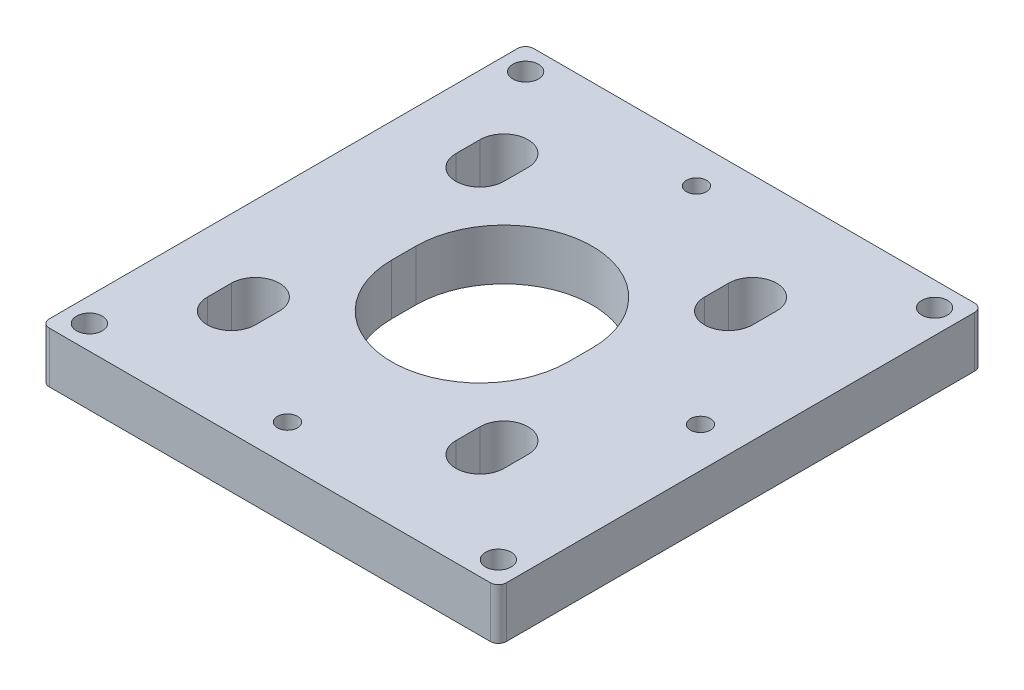
from build123d import *

# Parameters (mm, degrees)
SKETCH1_W                   = 57
SKETCH1_H                   = 60.4
BOSS_EXTRUDE1_DEPTH         = 6.35
M3_CLEARANCE_HOLE1_D        = 3.2
TAP_DRILL_FOR_M3X0_5_TAP1_D = 2.5
FILLET1_R                   = 1


with BuildPart() as part:
    # Sketch1 → Boss-Extrude1 (new body)
    with BuildSketch(Plane(origin=(0, 0, 0), x_dir=(1, 0, 0), z_dir=(0, 1, 0))):
        with Locations((2.5, 0)):
            Rectangle(SKETCH1_W, SKETCH1_H)
        with BuildLine():
            Line((-11, -1.5), (-11, 1.5))
            ThreePointArc((-11, 1.5), (0, 12.5), (11, 1.5))
            Line((11, 1.5), (11, -1.5))
            ThreePointArc((11, -1.5), (0, -12.5), (-11, -1.5))
        make_face(mode=Mode.SUBTRACT)
        with BuildLine():
            Line((-18.5, 14), (-18.5, 17))
            ThreePointArc((-18.5, 17), (-15.5, 20), (-12.5, 17))
            Line((-12.5, 17), (-12.5, 14))
            ThreePointArc((-12.5, 14), (-15.5, 11), (-18.5, 14))
        make_face(mode=Mode.SUBTRACT)
        with BuildLine():
            Line((12.5, 14), (12.5, 17))
            ThreePointArc((12.5, 17), (15.5, 20), (18.5, 17))
            Line((18.5, 17), (18.5, 14))
            ThreePointArc((18.5, 14), (15.5, 11), (12.5, 14))
        make_face(mode=Mode.SUBTRACT)
        with BuildLine():
            Line((12.5, -17), (12.5, -14))
            ThreePointArc((12.5, -14), (15.5, -11), (18.5, -14))
            Line((18.5, -14), (18.5, -17))
            ThreePointArc((18.5, -17), (15.5, -20), (12.5, -17))
        make_face(mode=Mode.SUBTRACT)
        with BuildLine():
            Line((-18.5, -17), (-18.5, -14))
            ThreePointArc((-18.5, -14), (-15.5, -11), (-12.5, -14))
            Line((-12.5, -14), (-12.5, -17))
            ThreePointArc((-12.5, -17), (-15.5, -20), (-18.5, -17))
        make_face(mode=Mode.SUBTRACT)
    extrude(amount=BOSS_EXTRUDE1_DEPTH)

    # M3 Clearance Hole1 (through all)
    with Locations(Plane(origin=(0, 6.35, 0), x_dir=(1, 0, 0), z_dir=(0, 1, 0))):
        with Locations((-23, -27.2), (28, -27.2), (28, 27.2), (-23, 27.2)):
            Hole(M3_CLEARANCE_HOLE1_D / 2)

    # Tap Drill for M3x0.5 Tap1 (through all)
    with Locations(Plane(origin=(0, 6.35, 0), x_dir=(1, 0, 0), z_dir=(0, 1, 0))):
        with Locations((26, 0), (0, 25.5), (0, -25.5)):
            Hole(TAP_DRILL_FOR_M3X0_5_TAP1_D / 2)

    # Fillet1
    fillet1_edges = [part.edges().sort_by_distance(p)[0] for p in [
        (-26, 3.175, 30.2),
        (31, 3.175, -30.2),
        (31, 3.175, 30.2),
        (-26, 3.175, -30.2),
    ]]
    fillet(fillet1_edges, radius=FILLET1_R)


solid = part.part
